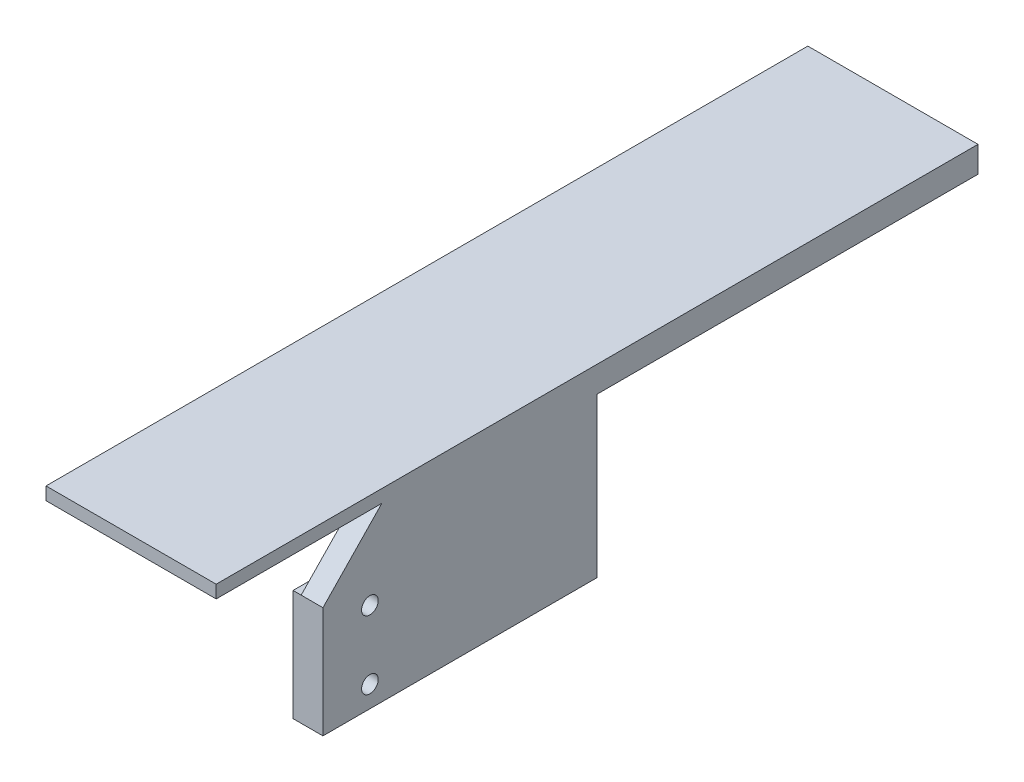
from build123d import *

# Parameters (mm, degrees)
LEG_AND_PAD_DEPTH                     = 13
SCREW_HEAD_RELIEF_SKETCH_W            = 14
SCREW_HEAD_RELIEF_SKETCH_H            = 6
SCREW_HEAD_RELIEF_DEPTH               = 2.35
M6_SLOT_MIDDLE_DEPTH                  = 3.5
SCREW_HOLES_SKETCH_R                  = 1.95
SCREW_HOLES_DEPTH                     = 4.5
FOOT_LEG_DEPTH                        = 6.1
SOLE_UNDER_THE_HOUSING_SKETCH_W       = 39.841788068
SOLE_UNDER_THE_HOUSING_SKETCH_H       = 135.03
SOLE_UNDER_THE_HOUSING_DEPTH          = 3.035
SOLE_UNDER_THE_BLOCK_SKETCH_W         = 39.841788068
SOLE_UNDER_THE_BLOCK_SKETCH_H         = 43.84
SOLE_UNDER_THE_BLOCK_DEPTH            = 1.5
SEAT_GUSSET_DEPTH                     = 2.55
TAIL_RIB_DEPTH                        = 3
SCREW_HEAD_RELIEF_TO_THE_END_SKETCH_W = 14
SCREW_HEAD_RELIEF_TO_THE_END_SKETCH_H = 16
SCREW_HEAD_RELIEF_TO_THE_END_DEPTH    = 2.35


with BuildPart() as part:
    # leg and pad sketch → leg and pad (new, symmetric)
    with BuildSketch(Plane(origin=(0, -20.7, 0), x_dir=(1, 0, 0), z_dir=(0, 1, 0))):
        Polygon((-0.551289683, 30.332713936), (-0.367250577, 30.819395741), (-0.028023026, 31.213926146), (0.425575667, 31.468833575), (0.938966578, 31.553446481), (1.450376329, 31.457583879), (1.898269923, 31.192780366), (2.228754897, 30.790898227), (2.402065893, 30.30029363), (2.397349395, 29.779998208), (2.215172912, 29.292616119), (1.877456693, 28.896791249), (1.424836191, 28.640150931), (0.91177263, 28.55357522), (0.4, 28.647481273), (0.4, -9.98), (1.92, -11.5), (1.92, -31.37), (8.92, -31.37), (8.92, 32.792642706), (-27.204821487, 54.594667874), (-30.821788068, 48.601542416), align=None)
    extrude(amount=LEG_AND_PAD_DEPTH, both=True)

    # screw head relief sketch → screw head relief (cut, symmetric)
    with BuildSketch(Plane(origin=(1.35, 0, 0), x_dir=(0, 0, -1), z_dir=(1, 0, 0))):
        with Locations((16.4, -9.7)):
            Rectangle(SCREW_HEAD_RELIEF_SKETCH_W, SCREW_HEAD_RELIEF_SKETCH_H)
    extrude(amount=SCREW_HEAD_RELIEF_DEPTH, both=True, mode=Mode.SUBTRACT)

    # insert flange relief sketch → insert flange relief (revolve, cut)
    with BuildSketch(Plane(origin=(0, -20.7, 0), x_dir=(1, 0, 0), z_dir=(0, 1, 0))):
        Polygon((-18.324853729, 39.891397061), (-17.03307995, 42.03179901), (-9.755713323, 37.639768162), (-11.047487102, 35.499366213), align=None)
    revolve(axis=Axis((-18.324853729, -20.7, -39.891397061), (0.5167095115681243, 0, -0.8561607796757748)), mode=Mode.SUBTRACT)

    # M6 slot end 1 sketch → M6 slot end 1 (revolve, cut)
    with BuildSketch(Plane(origin=(0, -20.7, 0), x_dir=(1, 0, 0), z_dir=(0, 1, 0))):
        Polygon((-20.893336068, 41.441525596), (-16.242950464, 49.146972613), (-13.246387735, 47.338489322), (-17.896773339, 39.633042305), align=None)
    revolve(axis=Axis((-20.893336068, -20.7, -41.441525596), (0.5167095115681233, 0, -0.8561607796757753)), mode=Mode.SUBTRACT)

    # M6 slot end 2 sketch → M6 slot end 2 (revolve, cut)
    with BuildSketch(Plane(origin=(0, -20.7, 0), x_dir=(1, 0, 0), z_dir=(0, 1, 0))):
        Polygon((-15.75637139, 38.341268526), (-11.105985786, 46.046715543), (-8.109423057, 44.238232253), (-12.759808661, 36.532785236), align=None)
    revolve(axis=Axis((-15.75637139, -20.7, -38.341268526), (0.5167095115681234, 0, -0.8561607796757752)), mode=Mode.SUBTRACT)

    # M6 slot middle sketch → M6 slot middle (cut, symmetric)
    with BuildSketch(Plane(origin=(0, -20.7, 0), x_dir=(1, 0, 0), z_dir=(0, 1, 0))):
        Polygon((-15.75637139, 38.341268526), (-20.893336068, 41.441525596), (-16.242950464, 49.146972613), (-11.105985786, 46.046715543), align=None)
    extrude(amount=M6_SLOT_MIDDLE_DEPTH, both=True, mode=Mode.SUBTRACT)

    # screw holes sketch → screw holes (cut, symmetric)
    with BuildSketch(Plane(origin=(5.42, 0, 0), x_dir=(0, 0, -1), z_dir=(1, 0, 0))):
        with Locations((-20.375, -28.7)):
            Circle(SCREW_HOLES_SKETCH_R)
        with Locations((-20.375, -12.7)):
            Circle(SCREW_HOLES_SKETCH_R)
    extrude(amount=SCREW_HOLES_DEPTH, both=True, mode=Mode.SUBTRACT)

    # foot leg sketch → foot leg (add, symmetric)
    with BuildSketch(Plane(origin=(0, -2.1, 0), x_dir=(1, 0, 0), z_dir=(0, 1, 0))):
        Polygon((2.3, 30.013511625), (2.3, -9.98), (8.92, -9.98), (8.92, 32.792642706), (-27.204821487, 54.594667874), (-30.201736654, 49.628935352), align=None)
    extrude(amount=FOOT_LEG_DEPTH, both=True)

    # sole under the housing sketch → sole under the housing (add, symmetric)
    with BuildSketch(Plane(origin=(0, 6.535, 0), x_dir=(1, 0, 0), z_dir=(0, 1, 0))):
        with Locations((-11.000894034, 54.485)):
            Rectangle(SOLE_UNDER_THE_HOUSING_SKETCH_W, SOLE_UNDER_THE_HOUSING_SKETCH_H)
    extrude(amount=SOLE_UNDER_THE_HOUSING_DEPTH, both=True)

    # sole under the block sketch → sole under the block (add, symmetric)
    with BuildSketch(Plane(origin=(0, 8.07, 0), x_dir=(1, 0, 0), z_dir=(0, 1, 0))):
        with Locations((-11.000894034, -34.45)):
            Rectangle(SOLE_UNDER_THE_BLOCK_SKETCH_W, SOLE_UNDER_THE_BLOCK_SKETCH_H)
    extrude(amount=SOLE_UNDER_THE_BLOCK_DEPTH, both=True)

    # seat gusset sketch → seat gusset (add, symmetric)
    with BuildSketch(Plane(origin=(6.37, 0, 0), x_dir=(0, 0, -1), z_dir=(1, 0, 0))):
        Polygon((-9.48, -8.2), (-31.37, -8.2), (-31.37, -7.7), (-17.1, 7.07), (-9.48, 7.07), align=None)
    extrude(amount=SEAT_GUSSET_DEPTH, both=True)

    # tail rib sketch → tail rib (add, symmetric)
    with BuildSketch(Plane(origin=(-19.921788068, 0, 0), x_dir=(0, 0, -1), z_dir=(1, 0, 0))):
        Polygon((53.1, 4), (53.1, -12.5), (57.1, -12.5), (120, 3.5), (120, 4), align=None)
    extrude(amount=TAIL_RIB_DEPTH, both=True)

    # screw head relief to the end sketch → screw head relief to the end (cut, symmetric)
    with BuildSketch(Plane(origin=(1.35, 0, 0), x_dir=(0, 0, -1), z_dir=(1, 0, 0))):
        with Locations((16.4, -4.7)):
            Rectangle(SCREW_HEAD_RELIEF_TO_THE_END_SKETCH_W, SCREW_HEAD_RELIEF_TO_THE_END_SKETCH_H)
    extrude(amount=SCREW_HEAD_RELIEF_TO_THE_END_DEPTH, both=True, mode=Mode.SUBTRACT)


solid = part.part
